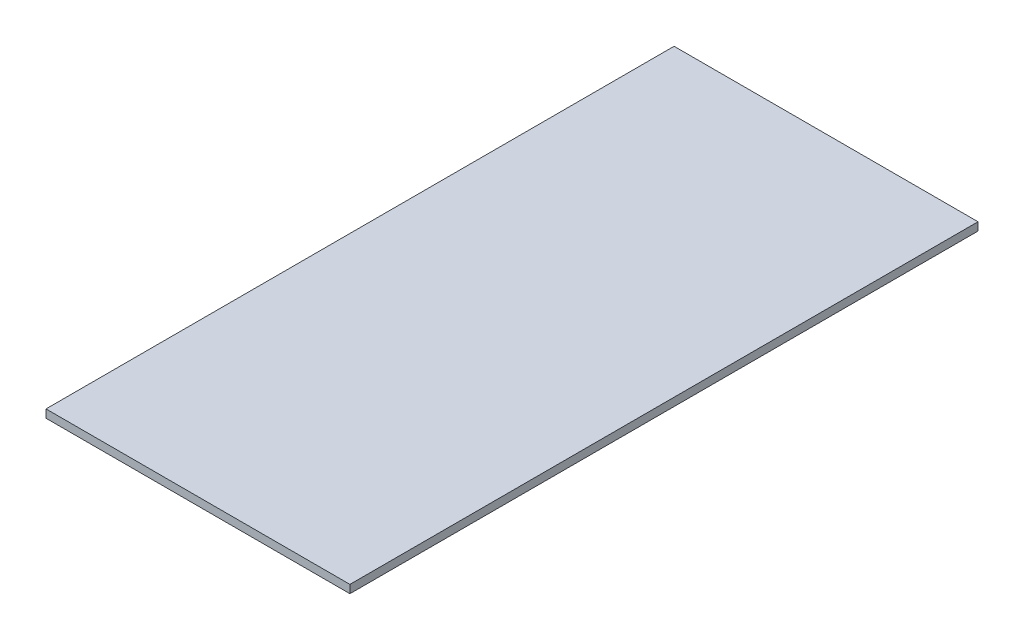
from build123d import *

# Parameters (mm, degrees)
CROQUIS1_W              = 150
CROQUIS1_H              = 310
SALIENTE_EXTRUIR1_DEPTH = 4


with BuildPart() as part:
    # Croquis1 → Saliente-Extruir1 (new body)
    with BuildSketch(Plane(origin=(0, 0, 0), x_dir=(1, 0, 0), z_dir=(0, 1, 0))):
        with Locations((-125, 0)):
            Rectangle(CROQUIS1_W, CROQUIS1_H)
    extrude(amount=SALIENTE_EXTRUIR1_DEPTH)


solid = part.part
